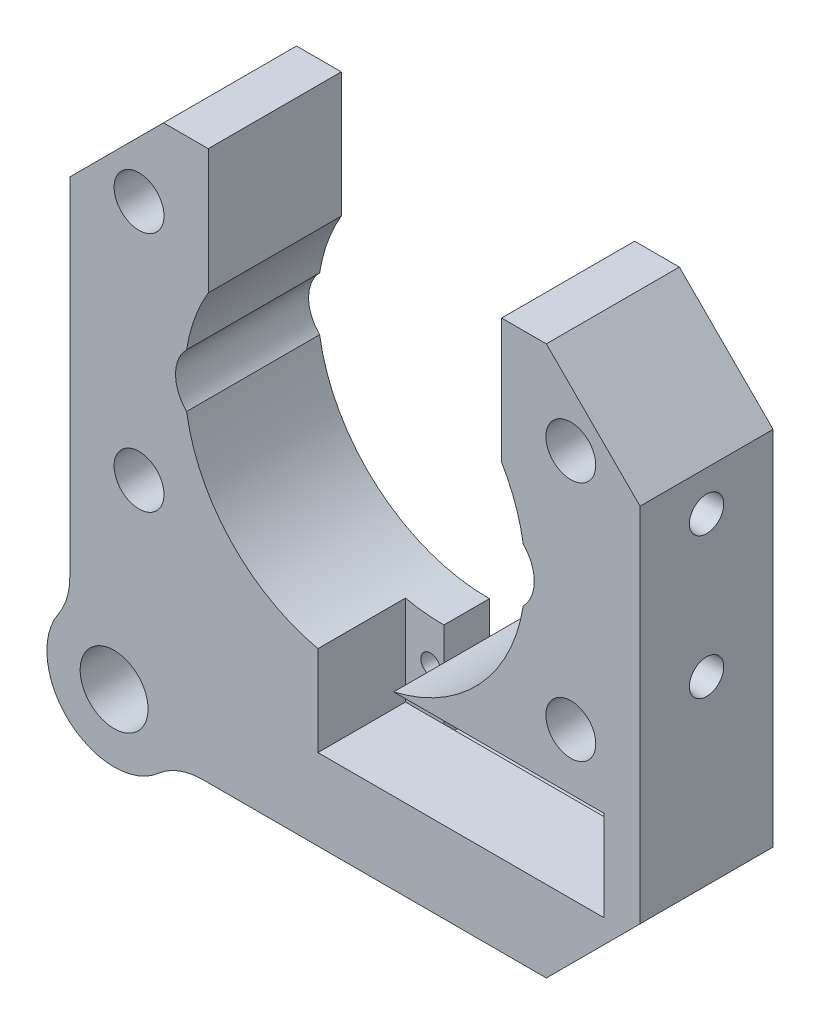
from build123d import *
from build123d.topology import SkipClean

# Parameters (mm, degrees)
SKETCH1_R                                       = 24.7015
SKETCH1_R_2                                     = 7.9375
BOSS_EXTRUDE1_DEPTH                             = 5.65
CBORE_SLOT_FOR_2_PAN_HEAD_MACHINE_SCREW_DEPTH   = 7
CBORE_SLOT_FOR_2_PAN_HEAD_MACHINE_S_3_DEPTH     = 1.5748
BOSS_EXTRUDE5_DEPTH                             = 12.7
BOSS_EXTRUDE8_DEPTH                             = 18.35
CUT_EXTRUDE3_DEPTH                              = 5.65
BOSS_EXTRUDE10_START                            = -12.7
SKETCH49_R                                      = 3.2385
BOSS_EXTRUDE10_DEPTH                            = 12.7
FILLET6_R                                       = 6.35
CBORE_FOR_2_PAN_HEAD_MACHINE_SCREW1_D           = 2.7051
CBORE_FOR_2_PAN_HEAD_MACHINE_SCREW1_CBORE_D     = 4.7625
CBORE_FOR_2_PAN_HEAD_MACHINE_SCREW1_CBORE_DEPTH = 7.9248
CUT_EXTRUDE5_START                              = -8.3551
SKETCH53_W                                      = 27.305
SKETCH53_H                                      = 8.636
CUT_EXTRUDE5_DEPTH                              = 8.3551
SKETCH54_W                                      = 20.1676
SKETCH54_H                                      = 9.652
CUT_EXTRUDE6_DEPTH                              = 10.16
CUT_EXTRUDE7_DEPTH                              = 44.478242884
CUT_EXTRUDE7_DEPTH_BACK                         = 44.478242884
SKETCH55_W                                      = 28
SKETCH55_H                                      = 5.861777857
F_0_CLEARANCE_HOLE1_D                           = 1.8542
FILLET7_R                                       = 6.35
SKETCH61_W                                      = 1.5
SKETCH61_H                                      = 3.302
SKETCH61_AT_POINT_2_W                           = 1.5
SKETCH61_AT_POINT_2_H                           = 3.302
SKETCH61_AT_POINT_3_W                           = 1.5
SKETCH61_AT_POINT_3_H                           = 3.302
SKETCH61_AT_POINT_4_W                           = 1.5
SKETCH61_AT_POINT_4_H                           = 3.302
SKETCH61_AT_POINT_5_W                           = 1.5
SKETCH61_AT_POINT_5_H                           = 3.302
SKETCH61_AT_POINT_6_W                           = 1.5
SKETCH61_AT_POINT_6_H                           = 3.302
CUT_EXTRUDE8_REACH                              = 45.478


with BuildPart() as part:
    # Sketch1 → Boss-Extrude1 (new body)
    with BuildSketch(Plane.XY):
        with Locations(Location((0, 0, 0), (0, 0, 180))):
            Circle(SKETCH1_R)
        with Locations(Location((0, 0, 0), (0, 0, 180))):
            Circle(SKETCH1_R_2, mode=Mode.SUBTRACT)
    extrude(amount=BOSS_EXTRUDE1_DEPTH)

    # CBORE SLOT for #2 Pan Head Machine Screw1: read off the stored shape, not the designer's step
    # CBORE SLOT for _2 Pan Head Machine S 2 → CBORE SLOT for #2 Pan Head Machine Screw1 (cut)
    with BuildSketch(Plane.XY):
        with BuildLine():
            ThreePointArc((-6.14045, 18.210667628), (-7.493, 19.563217628), (-8.84555, 18.210667628))
            Line((-8.84555, 18.210667628), (-8.84555, 14.565767628))
            ThreePointArc((-8.84555, 14.565767628), (-7.493, 13.213217628), (-6.14045, 14.565767628))
            Line((-6.14045, 14.565767628), (-6.14045, 18.210667628))
        make_face()
        with BuildLine():
            ThreePointArc((3.35915, 18.210667628), (2.0066, 19.563217628), (0.65405, 18.210667628))
            Line((0.65405, 18.210667628), (0.65405, 14.565767628))
            ThreePointArc((0.65405, 14.565767628), (2.0066, 13.213217628), (3.35915, 14.565767628))
            Line((3.35915, 14.565767628), (3.35915, 18.210667628))
        make_face()
    extrude(amount=CBORE_SLOT_FOR_2_PAN_HEAD_MACHINE_SCREW_DEPTH, mode=Mode.SUBTRACT)

    # CBORE SLOT for _2 Pan Head Machine S 3 o → CBORE SLOT for _2 Pan Head Machine S 3 (cut)
    # profile 1 of 2: a face of its own
    with BuildSketch(Plane.XY):
        with BuildLine():
            ThreePointArc((-5.11175, 18.210667628), (-7.493, 20.591917628), (-9.87425, 18.210667628))
            Line((-9.87425, 18.210667628), (-9.87425, 14.565767628))
            ThreePointArc((-9.87425, 14.565767628), (-7.493, 12.184517628), (-5.11175, 14.565767628))
            Line((-5.11175, 14.565767628), (-5.11175, 18.210667628))
        make_face()
        with BuildLine():
            Line((-8.84555, 14.565767628), (-8.84555, 18.210667628))
            ThreePointArc((-8.84555, 18.210667628), (-7.493, 19.563217628), (-6.14045, 18.210667628))
            Line((-6.14045, 18.210667628), (-6.14045, 14.565767628))
            ThreePointArc((-6.14045, 14.565767628), (-7.493, 13.213217628), (-8.84555, 14.565767628))
        make_face(mode=Mode.SUBTRACT)
    # profile 2 of 2: a face of its own
    with BuildSketch(Plane.XY):
        with BuildLine():
            ThreePointArc((4.38785, 18.210667628), (2.0066, 20.591917628), (-0.37465, 18.210667628))
            Line((-0.37465, 18.210667628), (-0.37465, 14.565767628))
            ThreePointArc((-0.37465, 14.565767628), (2.0066, 12.184517628), (4.38785, 14.565767628))
            Line((4.38785, 14.565767628), (4.38785, 18.210667628))
        make_face()
        with BuildLine():
            Line((0.65405, 14.565767628), (0.65405, 18.210667628))
            ThreePointArc((0.65405, 18.210667628), (2.0066, 19.563217628), (3.35915, 18.210667628))
            Line((3.35915, 18.210667628), (3.35915, 14.565767628))
            ThreePointArc((3.35915, 14.565767628), (2.0066, 13.213217628), (0.65405, 14.565767628))
        make_face(mode=Mode.SUBTRACT)
    extrude(amount=CBORE_SLOT_FOR_2_PAN_HEAD_MACHINE_S_3_DEPTH, mode=Mode.SUBTRACT)

    # CBORE SLOT for _2 Pan Head Machine S 4: loft between two sections, ruled curve by curve
    cbore_slot_for_2_pan_head_machine_s_4_from = [
        Edge.make_three_point_arc((-9.87425, 18.210667628, 1.03251), (-9.176798023, 19.89446565, 1.03251), (-7.493, 20.591917628, 1.03251)),
        Edge.make_three_point_arc((-7.493, 20.591917628, 1.03251), (-5.809201977, 19.89446565, 1.03251), (-5.11175, 18.210667628, 1.03251)),
        Edge.make_three_point_arc((-5.11175, 14.565767628, 1.03251), (-5.809201977, 12.881969605, 1.03251), (-7.493, 12.184517628, 1.03251)),
        Edge.make_three_point_arc((-7.493, 12.184517628, 1.03251), (-9.176798023, 12.881969605, 1.03251), (-9.87425, 14.565767628, 1.03251)),
        Edge.make_line((-5.11175, 18.210667628, 1.03251), (-5.11175, 14.565767628, 1.03251)),
        Edge.make_line((-9.87425, 18.210667628, 1.03251), (-9.87425, 14.565767628, 1.03251)),
    ]
    cbore_slot_for_2_pan_head_machine_s_4_to = [
        Edge.make_three_point_arc((-10.90676, 18.210667628, 0), (-9.906892845, 20.624560473, 0), (-7.493, 21.624427628, 0)),
        Edge.make_three_point_arc((-7.493, 21.624427628, 0), (-5.079107155, 20.624560473, 0), (-4.07924, 18.210667628, 0)),
        Edge.make_three_point_arc((-4.07924, 14.565767628, 0), (-5.079107155, 12.151874782, 0), (-7.493, 11.152007628, 0)),
        Edge.make_three_point_arc((-7.493, 11.152007628, 0), (-9.906892845, 12.151874782, 0), (-10.90676, 14.565767628, 0)),
        Edge.make_line((-4.07924, 18.210667628, 0), (-4.07924, 14.565767628, 0)),
        Edge.make_line((-10.90676, 18.210667628, 0), (-10.90676, 14.565767628, 0)),
    ]
    cbore_slot_for_2_pan_head_machine_s_4 = Solid(Shell([*[Face.make_surface_from_curves(cbore_slot_for_2_pan_head_machine_s_4_from[k], cbore_slot_for_2_pan_head_machine_s_4_to[k]) for k in range(6)], Face(Wire(cbore_slot_for_2_pan_head_machine_s_4_from)), Face(Wire(cbore_slot_for_2_pan_head_machine_s_4_to))]))
    add(cbore_slot_for_2_pan_head_machine_s_4, mode=Mode.SUBTRACT)

    # CBORE SLOT for _2 Pan Head Machine S 5: loft between two sections, ruled curve by curve
    cbore_slot_for_2_pan_head_machine_s_5_from = [
        Edge.make_three_point_arc((-0.37465, 18.210667628, 1.03251), (0.322801977, 19.89446565, 1.03251), (2.0066, 20.591917628, 1.03251)),
        Edge.make_three_point_arc((2.0066, 20.591917628, 1.03251), (3.690398023, 19.89446565, 1.03251), (4.38785, 18.210667628, 1.03251)),
        Edge.make_three_point_arc((4.38785, 14.565767628, 1.03251), (3.690398023, 12.881969605, 1.03251), (2.0066, 12.184517628, 1.03251)),
        Edge.make_three_point_arc((2.0066, 12.184517628, 1.03251), (0.322801977, 12.881969605, 1.03251), (-0.37465, 14.565767628, 1.03251)),
        Edge.make_line((4.38785, 18.210667628, 1.03251), (4.38785, 14.565767628, 1.03251)),
        Edge.make_line((-0.37465, 18.210667628, 1.03251), (-0.37465, 14.565767628, 1.03251)),
    ]
    cbore_slot_for_2_pan_head_machine_s_5_to = [
        Edge.make_three_point_arc((-1.40716, 18.210667628, 0), (-0.407292845, 20.624560473, 0), (2.0066, 21.624427628, 0)),
        Edge.make_three_point_arc((2.0066, 21.624427628, 0), (4.420492845, 20.624560473, 0), (5.42036, 18.210667628, 0)),
        Edge.make_three_point_arc((5.42036, 14.565767628, 0), (4.420492845, 12.151874782, 0), (2.0066, 11.152007628, 0)),
        Edge.make_three_point_arc((2.0066, 11.152007628, 0), (-0.407292845, 12.151874782, 0), (-1.40716, 14.565767628, 0)),
        Edge.make_line((5.42036, 18.210667628, 0), (5.42036, 14.565767628, 0)),
        Edge.make_line((-1.40716, 18.210667628, 0), (-1.40716, 14.565767628, 0)),
    ]
    cbore_slot_for_2_pan_head_machine_s_5 = Solid(Shell([*[Face.make_surface_from_curves(cbore_slot_for_2_pan_head_machine_s_5_from[k], cbore_slot_for_2_pan_head_machine_s_5_to[k]) for k in range(6)], Face(Wire(cbore_slot_for_2_pan_head_machine_s_5_from)), Face(Wire(cbore_slot_for_2_pan_head_machine_s_5_to))]))
    add(cbore_slot_for_2_pan_head_machine_s_5, mode=Mode.SUBTRACT)

    # Sketch11 → Boss-Extrude5 (add)
    with SkipClean():  # the faces are left unmerged after this step: merging them gives an invalid solid
        with BuildSketch(Plane.XY.offset(5.65)):
            with BuildLine():
                Line((-14, -4.5), (0.074191584, -4.5))
                Line((0.074191584, -4.5), (14, -4.5))
                Line((14, -4.5), (14, 20.351022143))
                ThreePointArc((14, 20.351022143), (0, -24.7015), (-14, 20.351022143))
                Line((-14, 20.351022143), (-14, -4.5))
            make_face()
        extrude(amount=BOSS_EXTRUDE5_DEPTH)

    # Sketch32 → Boss-Extrude8 (add)
    with SkipClean():  # the faces are left unmerged after this step: merging them gives an invalid solid
        with BuildSketch(Plane(origin=(0, 0, 0), x_dir=(-1, 0, 0), z_dir=(0, 0, -1))):
            with BuildLine():
                Line((-18.271623193, -26.2128), (7.425405769, -26.2128))
                ThreePointArc((7.425405769, -26.2128), (11.449135046, -24.775243659), (13.651025729, -21.113462268))
                ThreePointArc((13.651025729, -21.113462268), (13.71963315, -20.799474974), (13.798794659, -20.487981067))
                ThreePointArc((13.798794659, -20.487981067), (-17.466598155, 17.466598155), (20.487981067, -13.798794659))
                ThreePointArc((20.487981067, -13.798794659), (21.098318373, -13.654080759), (21.716857056, -13.549851983))
                ThreePointArc((21.716857056, -13.549851983), (25.649139633, -11.436206614), (27.21845798, -7.256782858))
                Line((27.21845798, -7.256782858), (27.21845798, 17.265965213))
                Line((27.21845798, 17.265965213), (18.271623193, 26.2128))
                Line((18.271623193, 26.2128), (-18.271623193, 26.2128))
                Line((-18.271623193, 26.2128), (-27.21845798, 17.265965213))
                Line((-27.21845798, 17.265965213), (-27.21845798, -17.265965213))
                Line((-27.21845798, -17.265965213), (-18.271623193, -26.2128))
            make_face()
        extrude(amount=-BOSS_EXTRUDE8_DEPTH)

    # Sketch36 → Cut-Extrude3 (cut)
    with BuildSketch(Plane(origin=(0, 0, 0), x_dir=(-1, 0, 0), z_dir=(0, 0, -1))):
        with BuildLine():
            Line((27.21845798, -7.256782858), (27.21845798, 17.265965213))
            Line((27.21845798, 17.265965213), (18.271623193, 26.2128))
            Line((18.271623193, 26.2128), (-18.271623193, 26.2128))
            Line((-18.271623193, 26.2128), (-27.21845798, 17.265965213))
            Line((-27.21845798, 17.265965213), (-27.21845798, -17.265965213))
            Line((-27.21845798, -17.265965213), (-18.271623193, -26.2128))
            Line((-18.271623193, -26.2128), (7.425405769, -26.2128))
            ThreePointArc((7.425405769, -26.2128), (11.449135046, -24.775243659), (13.651025729, -21.113462268))
            ThreePointArc((13.651025729, -21.113462268), (13.71963315, -20.799474974), (13.798794659, -20.487981067))
            ThreePointArc((13.798794659, -20.487981067), (17.466598155, -17.466598155), (20.487981067, -13.798794659))
            ThreePointArc((20.487981067, -13.798794659), (21.098318373, -13.654080759), (21.716857056, -13.549851983))
            ThreePointArc((21.716857056, -13.549851983), (25.649139633, -11.436206614), (27.21845798, -7.256782858))
        make_face()
    extrude(amount=-CUT_EXTRUDE3_DEPTH, mode=Mode.SUBTRACT)

    # Sketch49 → Boss-Extrude10 (add)
    with BuildSketch(Plane.XY.offset(18.35).offset(BOSS_EXTRUDE10_START)):
        with BuildLine():
            Line((-7.425405769, -26.2128), (-17.444815593, -26.2128))
            ThreePointArc((-17.444815593, -26.2128), (-27.06539703, -27.941191152), (-27.21845798, -18.167783584))
            Line((-27.21845798, -18.167783584), (-27.21845798, -7.256782858))
            ThreePointArc((-27.21845798, -7.256782858), (-25.649139633, -11.436206614), (-21.716857056, -13.549851983))
            ThreePointArc((-21.716857056, -13.549851983), (-21.098318373, -13.654080759), (-20.487981067, -13.798794659))
            ThreePointArc((-20.487981067, -13.798794659), (-17.466598155, -17.466598155), (-13.798794659, -20.487981067))
            ThreePointArc((-13.798794659, -20.487981067), (-13.71963315, -20.799474974), (-13.651025729, -21.113462268))
            ThreePointArc((-13.651025729, -21.113462268), (-11.449135046, -24.775243659), (-7.425405769, -26.2128))
        make_face()
        with Locations((-22.98945567, -22.98945567)):
            Circle(SKETCH49_R, mode=Mode.SUBTRACT)
    extrude(amount=BOSS_EXTRUDE10_DEPTH)

    # Fillet6
    fillet6_edges = [part.edges().sort_by_distance(p)[0] for p in [
        (-27.21845798, -18.167783584, 12),
        (-17.444815593, -26.2128, 12),
    ]]
    fillet(fillet6_edges, radius=FILLET6_R)

    # CBORE for #2 Pan Head Machine Screw1 (through all)
    with Locations(Plane.XY.offset(18.35)):
        with Locations((-20.60922899, 18.5346), (-20.60922899, -4.5), (20.60922899, -4.5), (20.60922899, 18.5346)):
            CounterBoreHole(CBORE_FOR_2_PAN_HEAD_MACHINE_SCREW1_D / 2, CBORE_FOR_2_PAN_HEAD_MACHINE_SCREW1_CBORE_D / 2, CBORE_FOR_2_PAN_HEAD_MACHINE_SCREW1_CBORE_DEPTH)

    # Sketch53 → Cut-Extrude5 (cut)
    with BuildSketch(Plane.XY.offset(18.35).offset(CUT_EXTRUDE5_START)):
        with Locations((10.1219, -14.1605)):
            Rectangle(SKETCH53_W, SKETCH53_H)
    extrude(amount=CUT_EXTRUDE5_DEPTH, mode=Mode.SUBTRACT)

    # Sketch54 → Cut-Extrude6 (cut)
    with BuildSketch(Plane.XY.offset(9.9949)):
        with Locations((10.2235, -14.6685)):
            Rectangle(SKETCH54_W, SKETCH54_H)
    extrude(amount=-CUT_EXTRUDE6_DEPTH, mode=Mode.SUBTRACT)

    # Sketch55 → Cut-Extrude7 (cut, two sides: drawn at the far end of the back side and taken through both)
    with BuildSketch(Plane.XY.offset(18.35).offset(-CUT_EXTRUDE7_DEPTH_BACK)):
        with Locations((0, 23.281911072)):
            Rectangle(SKETCH55_W, SKETCH55_H)
    extrude(amount=CUT_EXTRUDE7_DEPTH + CUT_EXTRUDE7_DEPTH_BACK, mode=Mode.SUBTRACT)

    # #0 Clearance Hole1 (through all)
    with Locations(Plane.XY.offset(9.9949)):
        with Locations((-1.143, -14.1605), (21.59, -14.1605)):
            Hole(F_0_CLEARANCE_HOLE1_D / 2)

    # Fillet7
    fillet7_edges = [part.edges().sort_by_distance(p)[0] for p in [
        (14, -4.5, 12),
        (-14, -4.5, 12),
    ]]
    fillet(fillet7_edges, radius=FILLET7_R)

    # Sketch60 → Hole5 (revolve, cut)
    with BuildSketch(Plane(origin=(27.21845798, 13.455965213, 12), x_dir=(0, 0, -1), z_dir=(0, 1, 0))):
        Polygon((0, 0), (0, 2.921), (1.4986, 2.921), (1.6383, 0), align=None)
    revolve(axis=Axis((-82.78154202, 13.455965213, 12), (1, 0, 0)), mode=Mode.SUBTRACT)

    # Sketch60 at point 2 (carried to point 2, square into its face) → Hole5 at 2 (revolve, cut)
    with BuildSketch(Plane(origin=(27.21845798, 0, 12), x_dir=(0, 0, -1), z_dir=(0, 1, 0))):
        Polygon((0, 0), (0, 2.921), (1.4986, 2.921), (1.6383, 0), align=None)
    revolve(axis=Axis((-82.78154202, 0, 12), (1, 0, 0)), mode=Mode.SUBTRACT)

    # Sketch60 at point 3 (carried to point 3, square into its face) → Hole5 at 3 (revolve, cut)
    with BuildSketch(Plane(origin=(-11.182556809, -26.2128, 10.213991308), x_dir=(0, 0, -1), z_dir=(1, 0, 0))):
        Polygon((0, 0), (0, 2.921), (1.4986, 2.921), (1.6383, 0), align=None)
    revolve(axis=Axis((-11.182556809, 83.7872, 10.213991308), (0, -1, 0)), mode=Mode.SUBTRACT)

    # Sketch60 at point 4 (carried to point 4, square into its face) → Hole5 at 4 (revolve, cut)
    with BuildSketch(Plane(origin=(14.461623193, -26.2128, 12), x_dir=(0, 0, -1), z_dir=(1, 0, 0))):
        Polygon((0, 0), (0, 2.921), (1.4986, 2.921), (1.6383, 0), align=None)
    revolve(axis=Axis((14.461623193, 83.7872, 12), (0, -1, 0)), mode=Mode.SUBTRACT)

    # Sketch60 at point 5 (carried to point 5, square into its face) → Hole5 at 5 (revolve, cut)
    with BuildSketch(Plane(origin=(-27.21845798, 13.455965213, 12), x_dir=(0, 0, -1), z_dir=(0, -1, 0))):
        Polygon((0, 0), (0, 2.921), (1.4986, 2.921), (1.6383, 0), align=None)
    revolve(axis=Axis((82.78154202, 13.455965213, 12), (-1, 0, 0)), mode=Mode.SUBTRACT)

    # Sketch60 at point 6 (carried to point 6, square into its face) → Hole5 at 6 (revolve, cut)
    with BuildSketch(Plane(origin=(-27.21845798, 0, 12), x_dir=(0, 0, -1), z_dir=(0, -1, 0))):
        Polygon((0, 0), (0, 2.921), (1.4986, 2.921), (1.6383, 0), align=None)
    revolve(axis=Axis((82.78154202, 0, 12), (-1, 0, 0)), mode=Mode.SUBTRACT)

    # Sketch61 → Ø3.0 (3) Diameter Hole1 (revolve, cut)
    with BuildSketch(Plane(origin=(-11.182556809, -23.2918, 10.213991308), x_dir=(0, 0, -1), z_dir=(1, 0, 0))):
        with Locations((0.75, 1.651)):
            Rectangle(SKETCH61_W, SKETCH61_H)
    revolve(axis=Axis((-11.182556809, -29.6418, 10.213991308), (0, 1, 0)), mode=Mode.SUBTRACT)

    # Sketch61 at point 2 (carried to point 2, square into its face) → Ø3.0 (3) Diameter Hole1 at 2 (revolve, cut)
    with BuildSketch(Plane(origin=(14.461623193, -23.2918, 12), x_dir=(0, 0, -1), z_dir=(1, 0, 0))):
        with Locations((0.75, 1.651)):
            Rectangle(SKETCH61_AT_POINT_2_W, SKETCH61_AT_POINT_2_H)
    revolve(axis=Axis((14.461623193, -29.6418, 12), (0, 1, 0)), mode=Mode.SUBTRACT)

    # Sketch61 at point 3 (carried to point 3, square into its face) → Ø3.0 (3) Diameter Hole1 at 3 (revolve, cut)
    with BuildSketch(Plane(origin=(24.29745798, 0, 12), x_dir=(0, 0, -1), z_dir=(0, 1, 0))):
        with Locations((0.75, 1.651)):
            Rectangle(SKETCH61_AT_POINT_3_W, SKETCH61_AT_POINT_3_H)
    revolve(axis=Axis((30.64745798, 0, 12), (-1, 0, 0)), mode=Mode.SUBTRACT)

    # Sketch61 at point 4 (carried to point 4, square into its face) → Ø3.0 (3) Diameter Hole1 at 4 (revolve, cut)
    with BuildSketch(Plane(origin=(24.29745798, 13.455965213, 12), x_dir=(0, 0, -1), z_dir=(0, 1, 0))):
        with Locations((0.75, 1.651)):
            Rectangle(SKETCH61_AT_POINT_4_W, SKETCH61_AT_POINT_4_H)
    revolve(axis=Axis((30.64745798, 13.455965213, 12), (-1, 0, 0)), mode=Mode.SUBTRACT)

    # Sketch61 at point 5 (carried to point 5, square into its face) → Ø3.0 (3) Diameter Hole1 at 5 (revolve, cut)
    with BuildSketch(Plane(origin=(-24.29745798, 13.455965213, 12), x_dir=(0, 0, -1), z_dir=(0, -1, 0))):
        with Locations((0.75, 1.651)):
            Rectangle(SKETCH61_AT_POINT_5_W, SKETCH61_AT_POINT_5_H)
    revolve(axis=Axis((-30.64745798, 13.455965213, 12), (1, 0, 0)), mode=Mode.SUBTRACT)

    # Sketch61 at point 6 (carried to point 6, square into its face) → Ø3.0 (3) Diameter Hole1 at 6 (revolve, cut)
    with BuildSketch(Plane(origin=(-24.29745798, 0, 12), x_dir=(0, 0, -1), z_dir=(0, -1, 0))):
        with Locations((0.75, 1.651)):
            Rectangle(SKETCH61_AT_POINT_6_W, SKETCH61_AT_POINT_6_H)
    revolve(axis=Axis((-30.64745798, 0, 12), (1, 0, 0)), mode=Mode.SUBTRACT)

    # Sketch62 → Cut-Extrude8 (cut, up to next)
    with BuildSketch(Plane.XY.offset(18.35), mode=Mode.PRIVATE) as cut_extrude8_sk1:
        with BuildLine():
            Line((4.72101684, 21.57), (-4.72101684, 21.57))
            ThreePointArc((-4.72101684, 21.57), (-12.265021185, 16.690283221), (-16.068833333, 8.550587247))
            ThreePointArc((-16.068833333, 8.550587247), (-17.12, 6), (-16.068833333, 3.449412753))
            ThreePointArc((-16.068833333, 3.449412753), (0, -10.27), (16.068833333, 3.449412753))
            ThreePointArc((16.068833333, 3.449412753), (17.12, 6), (16.068833333, 8.550587247))
            ThreePointArc((16.068833333, 8.550587247), (12.265021185, 16.690283221), (4.72101684, 21.57))
        make_face()
    cut_extrude8_tool1 = extrude(cut_extrude8_sk1.sketch, amount=-CUT_EXTRUDE8_REACH, mode=Mode.PRIVATE) & part.part
    add(cut_extrude8_tool1.solids().sort_by_distance((0, 5.91581, 18.35))[0], mode=Mode.SUBTRACT)


solid = part.part
